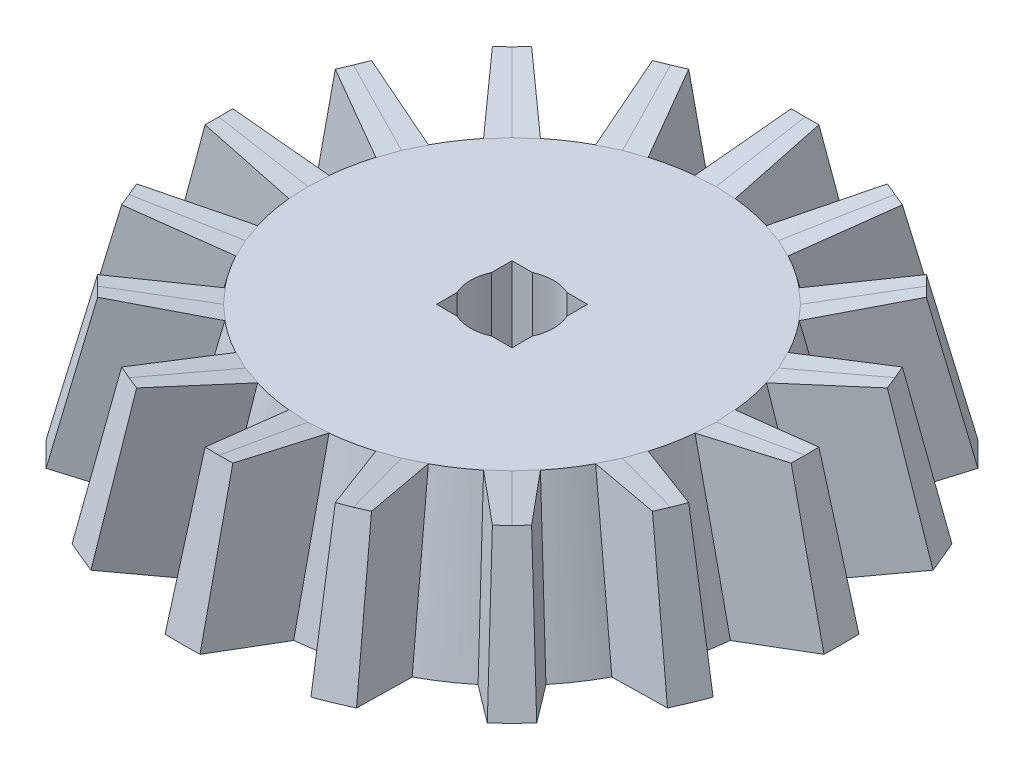
from build123d import *

# Parameters (mm, degrees)
BOSS_EXTRUDE1_DEPTH           = 3.8
BOSS_EXTRUDE1_TAPER           = 4
BOSS_EXTRUDE1_OTHER_WAY_DEPTH = 0.1
BOSS_EXTRUDE1_OTHER_WAY_DRAFT = 4
CIRPATTERN5_COUNT             = 16
CIRPATTERN5_COPY_1_DEPTH      = 0.1
CIRPATTERN5_COPY_1_DRAFT      = 4
CIRPATTERN5_COPY_2_DEPTH      = 0.1
CIRPATTERN5_COPY_2_DRAFT      = 4
CIRPATTERN5_COPY_3_DEPTH      = 0.1
CIRPATTERN5_COPY_3_DRAFT      = 4
CIRPATTERN5_COPY_4_DEPTH      = 0.1
CIRPATTERN5_COPY_4_DRAFT      = 4
CIRPATTERN5_COPY_5_DEPTH      = 0.1
CIRPATTERN5_COPY_5_DRAFT      = 4
CIRPATTERN5_COPY_6_DEPTH      = 0.1
CIRPATTERN5_COPY_6_DRAFT      = 4
CIRPATTERN5_COPY_7_DEPTH      = 0.1
CIRPATTERN5_COPY_7_DRAFT      = 4
CIRPATTERN5_COPY_8_DEPTH      = 0.1
CIRPATTERN5_COPY_8_DRAFT      = 4
CIRPATTERN5_COPY_9_DEPTH      = 0.1
CIRPATTERN5_COPY_9_DRAFT      = 4
CIRPATTERN5_COPY_10_DEPTH     = 0.1
CIRPATTERN5_COPY_10_DRAFT     = 4
CIRPATTERN5_COPY_11_DEPTH     = 0.1
CIRPATTERN5_COPY_11_DRAFT     = 4
CIRPATTERN5_COPY_12_DEPTH     = 0.1
CIRPATTERN5_COPY_12_DRAFT     = 4
CIRPATTERN5_COPY_13_DEPTH     = 0.1
CIRPATTERN5_COPY_13_DRAFT     = 4
CIRPATTERN5_COPY_14_DEPTH     = 0.1
CIRPATTERN5_COPY_14_DRAFT     = 4
CIRPATTERN5_COPY_15_DEPTH     = 0.1
CIRPATTERN5_COPY_15_DRAFT     = 4
CIRPATTERN5_COPY_16_DEPTH     = 0.1
CIRPATTERN5_COPY_16_DRAFT     = 4
CIRPATTERN5_COPY_17_DEPTH     = 0.1
CIRPATTERN5_COPY_17_DRAFT     = 4
CIRPATTERN5_COPY_18_DEPTH     = 0.1
CIRPATTERN5_COPY_18_DRAFT     = 4
CIRPATTERN5_COPY_19_DEPTH     = 0.1
CIRPATTERN5_COPY_19_DRAFT     = 4
CIRPATTERN5_COPY_20_DEPTH     = 0.1
CIRPATTERN5_COPY_20_DRAFT     = 4
CIRPATTERN5_COPY_21_DEPTH     = 0.1
CIRPATTERN5_COPY_21_DRAFT     = 4
CIRPATTERN5_COPY_22_DEPTH     = 0.1
CIRPATTERN5_COPY_22_DRAFT     = 4
CIRPATTERN5_COPY_23_DEPTH     = 0.1
CIRPATTERN5_COPY_23_DRAFT     = 4
CIRPATTERN5_COPY_24_DEPTH     = 0.1
CIRPATTERN5_COPY_24_DRAFT     = 4
CIRPATTERN5_COPY_25_DEPTH     = 0.1
CIRPATTERN5_COPY_25_DRAFT     = 4
CIRPATTERN5_COPY_26_DEPTH     = 0.1
CIRPATTERN5_COPY_26_DRAFT     = 4
CIRPATTERN5_COPY_27_DEPTH     = 0.1
CIRPATTERN5_COPY_27_DRAFT     = 4
CIRPATTERN5_COPY_28_DEPTH     = 0.1
CIRPATTERN5_COPY_28_DRAFT     = 4
CIRPATTERN5_COPY_29_DEPTH     = 0.1
CIRPATTERN5_COPY_29_DRAFT     = 4
CIRPATTERN5_COPY_30_DEPTH     = 0.1
CIRPATTERN5_COPY_30_DRAFT     = 4
SKETCH9_R                     = 1.75
CUT_EXTRUDE1_DEPTH            = 11.5
SKETCH10_W                    = 3.18
SKETCH10_H                    = 3.18
CUT_EXTRUDE3_DEPTH            = 10
SKETCH11_R                    = 13.97
CUT_EXTRUDE4_DEPTH            = 10


with BuildPart() as part:
    # Sketch1 → Revolve1 (revolve)
    with BuildSketch(Plane.XY):
        Polygon((0, 0), (10.264, 0), (8.599769277, 6.655068452), (0, 6.655068452), align=None)
    revolve(axis=Axis((0, 6.655068452, 0), (0, -1, 0)))

    # Sketch8 → Boss-Extrude1 (add)
    with BuildSketch(Plane(origin=(0, 2.41565258, 9.659918574), x_dir=(1, 0, 0), z_dir=(0, 0.24259923079541193, 0.9701265964901048))):
        Polygon((0, 4.369961495), (-0.8443, 4.380040474), (-1.0077, -2.478008782), (0, -2.490038505), (1.0077, -2.478008782), (0.8443, 4.380040474), align=None)
    boss_extrude1 = extrude(amount=BOSS_EXTRUDE1_DEPTH, taper=BOSS_EXTRUDE1_TAPER)


with BuildPart() as boss_extrude1_other_way_tool:
    # Sketch8 → Boss-Extrude1 other way (with draft: the straight prism first)
    with BuildSketch(Plane(origin=(0, 2.41565258, 9.659918574), x_dir=(1, 0, 0), z_dir=(0, 0.24259923079541193, 0.9701265964901048))):
        Polygon((0, 4.369961495), (-0.8443, 4.380040474), (-1.0077, -2.478008782), (0, -2.490038505), (1.0077, -2.478008782), (0.8443, 4.380040474), align=None)
    extrude(amount=-BOSS_EXTRUDE1_OTHER_WAY_DEPTH)
    # Boss-Extrude1 other way: the draft: its side faces are tilted about the plane it starts from
    boss_extrude1_other_way_sides = [boss_extrude1_other_way_tool.faces().sort_by_distance(p)[0] for p in [
        (-0.42215, 6.647827433, 8.550040371),
        (-0.926, 3.326128384, 9.380696532),
        (-0.50385, -0.006294784, 10.214034469),
        (0.50385, -0.006294784, 10.214034469),
        (0.926, 3.326128384, 9.380696532),
        (0.42215, 6.647827433, 8.550040371),
    ]]
    draft(boss_extrude1_other_way_sides, Plane(origin=(0, 2.41565258, 9.659918574), x_dir=(1, 0, 0), z_dir=(0, 0.24259923079541193, 0.9701265964901048)), BOSS_EXTRUDE1_OTHER_WAY_DRAFT)


with BuildPart() as part_1:
    add(part.part)

    # Boss-Extrude1 other way: add boss_extrude1_other_way_tool
    add(boss_extrude1_other_way_tool.part)

    # CirPattern5: Boss-Extrude1 ×16 about axis
    cirpattern5_axis = Axis((0, 67.611042395, 0), (0, -1, 0))
    for i in range(1, CIRPATTERN5_COUNT):
        add(boss_extrude1.rotate(cirpattern5_axis, i * 360 / CIRPATTERN5_COUNT))


with BuildPart() as cirpattern5_copy_1_tool:
    # CirPattern5 copy 1 sketch → CirPattern5 copy 1 (with draft: the straight prism first)
    with BuildSketch(Plane(origin=(-3.696690796, 2.41565258, 8.924601056), x_dir=(0.9238795325112867, 0, 0.3826834323650898), z_dir=(-0.37125137577349576, 0.24259923079541193, 0.8962801064420437))):
        Polygon((0, 4.369961495), (-0.8443, 4.380040474), (-1.0077, -2.478008782), (0, -2.490038505), (1.0077, -2.478008782), (0.8443, 4.380040474), align=None)
    extrude(amount=-CIRPATTERN5_COPY_1_DEPTH)
    # CirPattern5 copy 1: the draft: its side faces are tilted about the plane it starts from
    cirpattern5_copy_1_sides = [cirpattern5_copy_1_tool.faces().sort_by_distance(p)[0] for p in [
        (-3.661974541, 6.647827433, 7.73765749),
        (-4.445349594, 3.326128384, 8.312268668),
        (-4.374238471, -0.006294784, 9.243722343),
        (-3.443245066, -0.006294784, 9.629352438),
        (-2.7343247, 3.326128384, 9.020998385),
        (-2.881943051, 6.647827433, 8.060757112),
    ]]
    draft(cirpattern5_copy_1_sides, Plane(origin=(-3.696690796, 2.41565258, 8.924601056), x_dir=(0.9238795325112867, 0, 0.3826834323650898), z_dir=(-0.37125137577349576, 0.24259923079541193, 0.8962801064420437)), CIRPATTERN5_COPY_1_DRAFT)


with BuildPart() as part_2:
    add(part_1.part)

    # CirPattern5 copy 1: add cirpattern5_copy_1_tool
    add(cirpattern5_copy_1_tool.part)


with BuildPart() as cirpattern5_copy_2_tool:
    # CirPattern5 copy 2 sketch → CirPattern5 copy 2 (with draft: the straight prism first)
    with BuildSketch(Plane(origin=(-6.830593929, 2.41565258, 6.830593929), x_dir=(0.7071067811865476, 0, 0.7071067811865475), z_dir=(-0.6859830949875786, 0.24259923079541193, 0.6859830949875787))):
        Polygon((0, 4.369961495), (-0.8443, 4.380040474), (-1.0077, -2.478008782), (0, -2.490038505), (1.0077, -2.478008782), (0.8443, 4.380040474), align=None)
    extrude(amount=-CIRPATTERN5_COPY_2_DEPTH)
    # CirPattern5 copy 2: the draft: its side faces are tilted about the plane it starts from
    cirpattern5_copy_2_sides = [cirpattern5_copy_2_tool.faces().sort_by_distance(p)[0] for p in [
        (-6.344296653, 6.647827433, 5.747286398),
        (-7.287935009, 3.326128384, 5.978373251),
        (-7.578688788, -0.006294784, 6.866137285),
        (-6.866137285, -0.006294784, 7.578688788),
        (-5.978373251, 3.326128384, 7.287935009),
        (-5.747286398, 6.647827433, 6.344296653),
    ]]
    draft(cirpattern5_copy_2_sides, Plane(origin=(-6.830593929, 2.41565258, 6.830593929), x_dir=(0.7071067811865476, 0, 0.7071067811865475), z_dir=(-0.6859830949875786, 0.24259923079541193, 0.6859830949875787)), CIRPATTERN5_COPY_2_DRAFT)


with BuildPart() as part_3:
    add(part_2.part)

    # CirPattern5 copy 2: add cirpattern5_copy_2_tool
    add(cirpattern5_copy_2_tool.part)


with BuildPart() as cirpattern5_copy_3_tool:
    # CirPattern5 copy 3 sketch → CirPattern5 copy 3 (with draft: the straight prism first)
    with BuildSketch(Plane(origin=(-8.924601056, 2.41565258, 3.696690796), x_dir=(0.38268343236508984, 0, 0.9238795325112867), z_dir=(-0.8962801064420437, 0.24259923079541193, 0.3712513757734958))):
        Polygon((0, 4.369961495), (-0.8443, 4.380040474), (-1.0077, -2.478008782), (0, -2.490038505), (1.0077, -2.478008782), (0.8443, 4.380040474), align=None)
    extrude(amount=-CIRPATTERN5_COPY_3_DEPTH)
    # CirPattern5 copy 3: the draft: its side faces are tilted about the plane it starts from
    cirpattern5_copy_3_sides = [cirpattern5_copy_3_tool.faces().sort_by_distance(p)[0] for p in [
        (-8.060757112, 6.647827433, 2.881943051),
        (-9.020998385, 3.326128384, 2.7343247),
        (-9.629352438, -0.006294784, 3.443245066),
        (-9.243722343, -0.006294784, 4.374238471),
        (-8.312268668, 3.326128384, 4.445349594),
        (-7.73765749, 6.647827433, 3.661974541),
    ]]
    draft(cirpattern5_copy_3_sides, Plane(origin=(-8.924601056, 2.41565258, 3.696690796), x_dir=(0.38268343236508984, 0, 0.9238795325112867), z_dir=(-0.8962801064420437, 0.24259923079541193, 0.3712513757734958)), CIRPATTERN5_COPY_3_DRAFT)


with BuildPart() as part_4:
    add(part_3.part)

    # CirPattern5 copy 3: add cirpattern5_copy_3_tool
    add(cirpattern5_copy_3_tool.part)


with BuildPart() as cirpattern5_copy_4_tool:
    # CirPattern5 copy 4 sketch → CirPattern5 copy 4 (with draft: the straight prism first)
    with BuildSketch(Plane(origin=(-9.659918574, 2.41565258, 0), x_dir=(0, 0, 1), z_dir=(-0.9701265964901048, 0.24259923079541193, 0))):
        Polygon((0, 4.369961495), (-0.8443, 4.380040474), (-1.0077, -2.478008782), (0, -2.490038505), (1.0077, -2.478008782), (0.8443, 4.380040474), align=None)
    extrude(amount=-CIRPATTERN5_COPY_4_DEPTH)
    # CirPattern5 copy 4: the draft: its side faces are tilted about the plane it starts from
    cirpattern5_copy_4_sides = [cirpattern5_copy_4_tool.faces().sort_by_distance(p)[0] for p in [
        (-8.550040371, 6.647827433, -0.42215),
        (-9.380696532, 3.326128384, -0.926),
        (-10.214034469, -0.006294784, -0.50385),
        (-10.214034469, -0.006294784, 0.50385),
        (-9.380696532, 3.326128384, 0.926),
        (-8.550040371, 6.647827433, 0.42215),
    ]]
    draft(cirpattern5_copy_4_sides, Plane(origin=(-9.659918574, 2.41565258, 0), x_dir=(0, 0, 1), z_dir=(-0.9701265964901048, 0.24259923079541193, 0)), CIRPATTERN5_COPY_4_DRAFT)


with BuildPart() as part_5:
    add(part_4.part)

    # CirPattern5 copy 4: add cirpattern5_copy_4_tool
    add(cirpattern5_copy_4_tool.part)


with BuildPart() as cirpattern5_copy_5_tool:
    # CirPattern5 copy 5 sketch → CirPattern5 copy 5 (with draft: the straight prism first)
    with BuildSketch(Plane(origin=(-8.924601056, 2.41565258, -3.696690796), x_dir=(-0.3826834323650897, 0, 0.9238795325112867), z_dir=(-0.8962801064420437, 0.2425992307954119, -0.3712513757734957))):
        Polygon((0, 4.369961495), (-0.8443, 4.380040474), (-1.0077, -2.478008782), (0, -2.490038505), (1.0077, -2.478008782), (0.8443, 4.380040474), align=None)
    extrude(amount=-CIRPATTERN5_COPY_5_DEPTH)
    # CirPattern5 copy 5: the draft: its side faces are tilted about the plane it starts from
    cirpattern5_copy_5_sides = [cirpattern5_copy_5_tool.faces().sort_by_distance(p)[0] for p in [
        (-7.73765749, 6.647827433, -3.661974541),
        (-8.312268668, 3.326128384, -4.445349594),
        (-9.243722343, -0.006294784, -4.374238471),
        (-9.629352438, -0.006294784, -3.443245066),
        (-9.020998385, 3.326128384, -2.7343247),
        (-8.060757112, 6.647827433, -2.881943051),
    ]]
    draft(cirpattern5_copy_5_sides, Plane(origin=(-8.924601056, 2.41565258, -3.696690796), x_dir=(-0.3826834323650897, 0, 0.9238795325112867), z_dir=(-0.8962801064420437, 0.2425992307954119, -0.3712513757734957)), CIRPATTERN5_COPY_5_DRAFT)


with BuildPart() as part_6:
    add(part_5.part)

    # CirPattern5 copy 5: add cirpattern5_copy_5_tool
    add(cirpattern5_copy_5_tool.part)


with BuildPart() as cirpattern5_copy_6_tool:
    # CirPattern5 copy 6 sketch → CirPattern5 copy 6 (with draft: the straight prism first)
    with BuildSketch(Plane(origin=(-6.830593929, 2.41565258, -6.830593929), x_dir=(-0.7071067811865475, 0, 0.7071067811865476), z_dir=(-0.6859830949875787, 0.24259923079541193, -0.6859830949875786))):
        Polygon((0, 4.369961495), (-0.8443, 4.380040474), (-1.0077, -2.478008782), (0, -2.490038505), (1.0077, -2.478008782), (0.8443, 4.380040474), align=None)
    extrude(amount=-CIRPATTERN5_COPY_6_DEPTH)
    # CirPattern5 copy 6: the draft: its side faces are tilted about the plane it starts from
    cirpattern5_copy_6_sides = [cirpattern5_copy_6_tool.faces().sort_by_distance(p)[0] for p in [
        (-5.747286398, 6.647827433, -6.344296653),
        (-5.978373251, 3.326128384, -7.287935009),
        (-6.866137285, -0.006294784, -7.578688788),
        (-7.578688788, -0.006294784, -6.866137285),
        (-7.287935009, 3.326128384, -5.978373251),
        (-6.344296653, 6.647827433, -5.747286398),
    ]]
    draft(cirpattern5_copy_6_sides, Plane(origin=(-6.830593929, 2.41565258, -6.830593929), x_dir=(-0.7071067811865475, 0, 0.7071067811865476), z_dir=(-0.6859830949875787, 0.24259923079541193, -0.6859830949875786)), CIRPATTERN5_COPY_6_DRAFT)


with BuildPart() as part_7:
    add(part_6.part)

    # CirPattern5 copy 6: add cirpattern5_copy_6_tool
    add(cirpattern5_copy_6_tool.part)


with BuildPart() as cirpattern5_copy_7_tool:
    # CirPattern5 copy 7 sketch → CirPattern5 copy 7 (with draft: the straight prism first)
    with BuildSketch(Plane(origin=(-3.696690796, 2.41565258, -8.924601056), x_dir=(-0.9238795325112867, 0, 0.3826834323650899), z_dir=(-0.3712513757734959, 0.24259923079541193, -0.8962801064420437))):
        Polygon((0, 4.369961495), (-0.8443, 4.380040474), (-1.0077, -2.478008782), (0, -2.490038505), (1.0077, -2.478008782), (0.8443, 4.380040474), align=None)
    extrude(amount=-CIRPATTERN5_COPY_7_DEPTH)
    # CirPattern5 copy 7: the draft: its side faces are tilted about the plane it starts from
    cirpattern5_copy_7_sides = [cirpattern5_copy_7_tool.faces().sort_by_distance(p)[0] for p in [
        (-2.881943051, 6.647827433, -8.060757112),
        (-2.7343247, 3.326128384, -9.020998385),
        (-3.443245066, -0.006294784, -9.629352438),
        (-4.374238471, -0.006294784, -9.243722343),
        (-4.445349594, 3.326128384, -8.312268668),
        (-3.661974541, 6.647827433, -7.73765749),
    ]]
    draft(cirpattern5_copy_7_sides, Plane(origin=(-3.696690796, 2.41565258, -8.924601056), x_dir=(-0.9238795325112867, 0, 0.3826834323650899), z_dir=(-0.3712513757734959, 0.24259923079541193, -0.8962801064420437)), CIRPATTERN5_COPY_7_DRAFT)


with BuildPart() as part_8:
    add(part_7.part)

    # CirPattern5 copy 7: add cirpattern5_copy_7_tool
    add(cirpattern5_copy_7_tool.part)


with BuildPart() as cirpattern5_copy_8_tool:
    # CirPattern5 copy 8 sketch → CirPattern5 copy 8 (with draft: the straight prism first)
    with BuildSketch(Plane(origin=(0, 2.41565258, -9.659918574), x_dir=(-1, 0, 0), z_dir=(0, 0.24259923079541193, -0.9701265964901048))):
        Polygon((0, 4.369961495), (-0.8443, 4.380040474), (-1.0077, -2.478008782), (0, -2.490038505), (1.0077, -2.478008782), (0.8443, 4.380040474), align=None)
    extrude(amount=-CIRPATTERN5_COPY_8_DEPTH)
    # CirPattern5 copy 8: the draft: its side faces are tilted about the plane it starts from
    cirpattern5_copy_8_sides = [cirpattern5_copy_8_tool.faces().sort_by_distance(p)[0] for p in [
        (0.42215, 6.647827433, -8.550040371),
        (0.926, 3.326128384, -9.380696532),
        (0.50385, -0.006294784, -10.214034469),
        (-0.50385, -0.006294784, -10.214034469),
        (-0.926, 3.326128384, -9.380696532),
        (-0.42215, 6.647827433, -8.550040371),
    ]]
    draft(cirpattern5_copy_8_sides, Plane(origin=(0, 2.41565258, -9.659918574), x_dir=(-1, 0, 0), z_dir=(0, 0.24259923079541193, -0.9701265964901048)), CIRPATTERN5_COPY_8_DRAFT)


with BuildPart() as part_9:
    add(part_8.part)

    # CirPattern5 copy 8: add cirpattern5_copy_8_tool
    add(cirpattern5_copy_8_tool.part)


with BuildPart() as cirpattern5_copy_9_tool:
    # CirPattern5 copy 9 sketch → CirPattern5 copy 9 (with draft: the straight prism first)
    with BuildSketch(Plane(origin=(3.696690796, 2.41565258, -8.924601056), x_dir=(-0.9238795325112868, 0, -0.38268343236508967), z_dir=(0.37125137577349565, 0.24259923079541193, -0.8962801064420438))):
        Polygon((0, 4.369961495), (-0.8443, 4.380040474), (-1.0077, -2.478008782), (0, -2.490038505), (1.0077, -2.478008782), (0.8443, 4.380040474), align=None)
    extrude(amount=-CIRPATTERN5_COPY_9_DEPTH)
    # CirPattern5 copy 9: the draft: its side faces are tilted about the plane it starts from
    cirpattern5_copy_9_sides = [cirpattern5_copy_9_tool.faces().sort_by_distance(p)[0] for p in [
        (3.661974541, 6.647827433, -7.73765749),
        (4.445349594, 3.326128384, -8.312268668),
        (4.374238471, -0.006294784, -9.243722343),
        (3.443245066, -0.006294784, -9.629352438),
        (2.7343247, 3.326128384, -9.020998385),
        (2.881943051, 6.647827433, -8.060757112),
    ]]
    draft(cirpattern5_copy_9_sides, Plane(origin=(3.696690796, 2.41565258, -8.924601056), x_dir=(-0.9238795325112868, 0, -0.38268343236508967), z_dir=(0.37125137577349565, 0.24259923079541193, -0.8962801064420438)), CIRPATTERN5_COPY_9_DRAFT)


with BuildPart() as part_10:
    add(part_9.part)

    # CirPattern5 copy 9: add cirpattern5_copy_9_tool
    add(cirpattern5_copy_9_tool.part)


with BuildPart() as cirpattern5_copy_10_tool:
    # CirPattern5 copy 10 sketch → CirPattern5 copy 10 (with draft: the straight prism first)
    with BuildSketch(Plane(origin=(6.830593929, 2.41565258, -6.830593929), x_dir=(-0.7071067811865477, 0, -0.7071067811865475), z_dir=(0.6859830949875786, 0.24259923079541193, -0.6859830949875788))):
        Polygon((0, 4.369961495), (-0.8443, 4.380040474), (-1.0077, -2.478008782), (0, -2.490038505), (1.0077, -2.478008782), (0.8443, 4.380040474), align=None)
    extrude(amount=-CIRPATTERN5_COPY_10_DEPTH)
    # CirPattern5 copy 10: the draft: its side faces are tilted about the plane it starts from
    cirpattern5_copy_10_sides = [cirpattern5_copy_10_tool.faces().sort_by_distance(p)[0] for p in [
        (6.344296653, 6.647827433, -5.747286398),
        (7.287935009, 3.326128384, -5.978373251),
        (7.578688788, -0.006294784, -6.866137285),
        (6.866137285, -0.006294784, -7.578688788),
        (5.978373251, 3.326128384, -7.287935009),
        (5.747286398, 6.647827433, -6.344296653),
    ]]
    draft(cirpattern5_copy_10_sides, Plane(origin=(6.830593929, 2.41565258, -6.830593929), x_dir=(-0.7071067811865477, 0, -0.7071067811865475), z_dir=(0.6859830949875786, 0.24259923079541193, -0.6859830949875788)), CIRPATTERN5_COPY_10_DRAFT)


with BuildPart() as part_11:
    add(part_10.part)

    # CirPattern5 copy 10: add cirpattern5_copy_10_tool
    add(cirpattern5_copy_10_tool.part)


with BuildPart() as cirpattern5_copy_11_tool:
    # CirPattern5 copy 11 sketch → CirPattern5 copy 11 (with draft: the straight prism first)
    with BuildSketch(Plane(origin=(8.924601056, 2.41565258, -3.696690796), x_dir=(-0.3826834323650895, 0, -0.9238795325112868), z_dir=(0.8962801064420438, 0.24259923079541193, -0.3712513757734955))):
        Polygon((0, 4.369961495), (-0.8443, 4.380040474), (-1.0077, -2.478008782), (0, -2.490038505), (1.0077, -2.478008782), (0.8443, 4.380040474), align=None)
    extrude(amount=-CIRPATTERN5_COPY_11_DEPTH)
    # CirPattern5 copy 11: the draft: its side faces are tilted about the plane it starts from
    cirpattern5_copy_11_sides = [cirpattern5_copy_11_tool.faces().sort_by_distance(p)[0] for p in [
        (8.060757112, 6.647827433, -2.881943051),
        (9.020998385, 3.326128384, -2.7343247),
        (9.629352438, -0.006294784, -3.443245066),
        (9.243722343, -0.006294784, -4.374238471),
        (8.312268668, 3.326128384, -4.445349594),
        (7.73765749, 6.647827433, -3.661974541),
    ]]
    draft(cirpattern5_copy_11_sides, Plane(origin=(8.924601056, 2.41565258, -3.696690796), x_dir=(-0.3826834323650895, 0, -0.9238795325112868), z_dir=(0.8962801064420438, 0.24259923079541193, -0.3712513757734955)), CIRPATTERN5_COPY_11_DRAFT)


with BuildPart() as part_12:
    add(part_11.part)

    # CirPattern5 copy 11: add cirpattern5_copy_11_tool
    add(cirpattern5_copy_11_tool.part)


with BuildPart() as cirpattern5_copy_12_tool:
    # CirPattern5 copy 12 sketch → CirPattern5 copy 12 (with draft: the straight prism first)
    with BuildSketch(Plane(origin=(9.659918574, 2.41565258, 0), x_dir=(0, 0, -1), z_dir=(0.9701265964901048, 0.24259923079541193, 0))):
        Polygon((0, 4.369961495), (-0.8443, 4.380040474), (-1.0077, -2.478008782), (0, -2.490038505), (1.0077, -2.478008782), (0.8443, 4.380040474), align=None)
    extrude(amount=-CIRPATTERN5_COPY_12_DEPTH)
    # CirPattern5 copy 12: the draft: its side faces are tilted about the plane it starts from
    cirpattern5_copy_12_sides = [cirpattern5_copy_12_tool.faces().sort_by_distance(p)[0] for p in [
        (8.550040371, 6.647827433, 0.42215),
        (9.380696532, 3.326128384, 0.926),
        (10.214034469, -0.006294784, 0.50385),
        (10.214034469, -0.006294784, -0.50385),
        (9.380696532, 3.326128384, -0.926),
        (8.550040371, 6.647827433, -0.42215),
    ]]
    draft(cirpattern5_copy_12_sides, Plane(origin=(9.659918574, 2.41565258, 0), x_dir=(0, 0, -1), z_dir=(0.9701265964901048, 0.24259923079541193, 0)), CIRPATTERN5_COPY_12_DRAFT)


with BuildPart() as part_13:
    add(part_12.part)

    # CirPattern5 copy 12: add cirpattern5_copy_12_tool
    add(cirpattern5_copy_12_tool.part)


with BuildPart() as cirpattern5_copy_13_tool:
    # CirPattern5 copy 13 sketch → CirPattern5 copy 13 (with draft: the straight prism first)
    with BuildSketch(Plane(origin=(8.924601056, 2.41565258, 3.696690796), x_dir=(0.38268343236509, 0, -0.9238795325112866), z_dir=(0.8962801064420436, 0.24259923079541193, 0.371251375773496))):
        Polygon((0, 4.369961495), (-0.8443, 4.380040474), (-1.0077, -2.478008782), (0, -2.490038505), (1.0077, -2.478008782), (0.8443, 4.380040474), align=None)
    extrude(amount=-CIRPATTERN5_COPY_13_DEPTH)
    # CirPattern5 copy 13: the draft: its side faces are tilted about the plane it starts from
    cirpattern5_copy_13_sides = [cirpattern5_copy_13_tool.faces().sort_by_distance(p)[0] for p in [
        (7.73765749, 6.647827433, 3.661974541),
        (8.312268668, 3.326128384, 4.445349594),
        (9.243722343, -0.006294784, 4.374238471),
        (9.629352438, -0.006294784, 3.443245066),
        (9.020998385, 3.326128384, 2.7343247),
        (8.060757112, 6.647827433, 2.881943051),
    ]]
    draft(cirpattern5_copy_13_sides, Plane(origin=(8.924601056, 2.41565258, 3.696690796), x_dir=(0.38268343236509, 0, -0.9238795325112866), z_dir=(0.8962801064420436, 0.24259923079541193, 0.371251375773496)), CIRPATTERN5_COPY_13_DRAFT)


with BuildPart() as part_14:
    add(part_13.part)

    # CirPattern5 copy 13: add cirpattern5_copy_13_tool
    add(cirpattern5_copy_13_tool.part)


with BuildPart() as cirpattern5_copy_14_tool:
    # CirPattern5 copy 14 sketch → CirPattern5 copy 14 (with draft: the straight prism first)
    with BuildSketch(Plane(origin=(6.830593929, 2.41565258, 6.830593929), x_dir=(0.7071067811865474, 0, -0.7071067811865477), z_dir=(0.6859830949875788, 0.24259923079541193, 0.6859830949875785))):
        Polygon((0, 4.369961495), (-0.8443, 4.380040474), (-1.0077, -2.478008782), (0, -2.490038505), (1.0077, -2.478008782), (0.8443, 4.380040474), align=None)
    extrude(amount=-CIRPATTERN5_COPY_14_DEPTH)
    # CirPattern5 copy 14: the draft: its side faces are tilted about the plane it starts from
    cirpattern5_copy_14_sides = [cirpattern5_copy_14_tool.faces().sort_by_distance(p)[0] for p in [
        (5.747286398, 6.647827433, 6.344296653),
        (5.978373251, 3.326128384, 7.287935009),
        (6.866137285, -0.006294784, 7.578688788),
        (7.578688788, -0.006294784, 6.866137285),
        (7.287935009, 3.326128384, 5.978373251),
        (6.344296653, 6.647827433, 5.747286398),
    ]]
    draft(cirpattern5_copy_14_sides, Plane(origin=(6.830593929, 2.41565258, 6.830593929), x_dir=(0.7071067811865474, 0, -0.7071067811865477), z_dir=(0.6859830949875788, 0.24259923079541193, 0.6859830949875785)), CIRPATTERN5_COPY_14_DRAFT)


with BuildPart() as part_15:
    add(part_14.part)

    # CirPattern5 copy 14: add cirpattern5_copy_14_tool
    add(cirpattern5_copy_14_tool.part)


with BuildPart() as cirpattern5_copy_15_tool:
    # CirPattern5 copy 15 sketch → CirPattern5 copy 15 (with draft: the straight prism first)
    with BuildSketch(Plane(origin=(3.696690796, 2.41565258, 8.924601056), x_dir=(0.9238795325112868, 0, -0.38268343236508956), z_dir=(0.37125137577349554, 0.24259923079541193, 0.8962801064420438))):
        Polygon((0, 4.369961495), (-0.8443, 4.380040474), (-1.0077, -2.478008782), (0, -2.490038505), (1.0077, -2.478008782), (0.8443, 4.380040474), align=None)
    extrude(amount=-CIRPATTERN5_COPY_15_DEPTH)
    # CirPattern5 copy 15: the draft: its side faces are tilted about the plane it starts from
    cirpattern5_copy_15_sides = [cirpattern5_copy_15_tool.faces().sort_by_distance(p)[0] for p in [
        (2.881943051, 6.647827433, 8.060757112),
        (2.7343247, 3.326128384, 9.020998385),
        (3.443245066, -0.006294784, 9.629352438),
        (4.374238471, -0.006294784, 9.243722343),
        (4.445349594, 3.326128384, 8.312268668),
        (3.661974541, 6.647827433, 7.73765749),
    ]]
    draft(cirpattern5_copy_15_sides, Plane(origin=(3.696690796, 2.41565258, 8.924601056), x_dir=(0.9238795325112868, 0, -0.38268343236508956), z_dir=(0.37125137577349554, 0.24259923079541193, 0.8962801064420438)), CIRPATTERN5_COPY_15_DRAFT)


with BuildPart() as part_16:
    add(part_15.part)

    # CirPattern5 copy 15: add cirpattern5_copy_15_tool
    add(cirpattern5_copy_15_tool.part)


with BuildPart() as cirpattern5_copy_16_tool:
    # CirPattern5 copy 16 sketch → CirPattern5 copy 16 (with draft: the straight prism first)
    with BuildSketch(Plane(origin=(-3.696690796, 2.41565258, 8.924601056), x_dir=(0.9238795325112867, 0, 0.3826834323650898), z_dir=(-0.37125137577349576, 0.24259923079541193, 0.8962801064420437))):
        Polygon((0, 4.369961495), (-0.8443, 4.380040474), (-1.0077, -2.478008782), (0, -2.490038505), (1.0077, -2.478008782), (0.8443, 4.380040474), align=None)
    extrude(amount=-CIRPATTERN5_COPY_16_DEPTH)
    # CirPattern5 copy 16: the draft: its side faces are tilted about the plane it starts from
    cirpattern5_copy_16_sides = [cirpattern5_copy_16_tool.faces().sort_by_distance(p)[0] for p in [
        (-3.661974541, 6.647827433, 7.73765749),
        (-4.445349594, 3.326128384, 8.312268668),
        (-4.374238471, -0.006294784, 9.243722343),
        (-3.443245066, -0.006294784, 9.629352438),
        (-2.7343247, 3.326128384, 9.020998385),
        (-2.881943051, 6.647827433, 8.060757112),
    ]]
    draft(cirpattern5_copy_16_sides, Plane(origin=(-3.696690796, 2.41565258, 8.924601056), x_dir=(0.9238795325112867, 0, 0.3826834323650898), z_dir=(-0.37125137577349576, 0.24259923079541193, 0.8962801064420437)), CIRPATTERN5_COPY_16_DRAFT)


with BuildPart() as part_17:
    add(part_16.part)

    # CirPattern5 copy 16: add cirpattern5_copy_16_tool
    add(cirpattern5_copy_16_tool.part)


with BuildPart() as cirpattern5_copy_17_tool:
    # CirPattern5 copy 17 sketch → CirPattern5 copy 17 (with draft: the straight prism first)
    with BuildSketch(Plane(origin=(-6.830593929, 2.41565258, 6.830593929), x_dir=(0.7071067811865476, 0, 0.7071067811865475), z_dir=(-0.6859830949875786, 0.24259923079541193, 0.6859830949875787))):
        Polygon((0, 4.369961495), (-0.8443, 4.380040474), (-1.0077, -2.478008782), (0, -2.490038505), (1.0077, -2.478008782), (0.8443, 4.380040474), align=None)
    extrude(amount=-CIRPATTERN5_COPY_17_DEPTH)
    # CirPattern5 copy 17: the draft: its side faces are tilted about the plane it starts from
    cirpattern5_copy_17_sides = [cirpattern5_copy_17_tool.faces().sort_by_distance(p)[0] for p in [
        (-6.344296653, 6.647827433, 5.747286398),
        (-7.287935009, 3.326128384, 5.978373251),
        (-7.578688788, -0.006294784, 6.866137285),
        (-6.866137285, -0.006294784, 7.578688788),
        (-5.978373251, 3.326128384, 7.287935009),
        (-5.747286398, 6.647827433, 6.344296653),
    ]]
    draft(cirpattern5_copy_17_sides, Plane(origin=(-6.830593929, 2.41565258, 6.830593929), x_dir=(0.7071067811865476, 0, 0.7071067811865475), z_dir=(-0.6859830949875786, 0.24259923079541193, 0.6859830949875787)), CIRPATTERN5_COPY_17_DRAFT)


with BuildPart() as part_18:
    add(part_17.part)

    # CirPattern5 copy 17: add cirpattern5_copy_17_tool
    add(cirpattern5_copy_17_tool.part)


with BuildPart() as cirpattern5_copy_18_tool:
    # CirPattern5 copy 18 sketch → CirPattern5 copy 18 (with draft: the straight prism first)
    with BuildSketch(Plane(origin=(-8.924601056, 2.41565258, 3.696690796), x_dir=(0.38268343236508984, 0, 0.9238795325112867), z_dir=(-0.8962801064420437, 0.24259923079541193, 0.3712513757734958))):
        Polygon((0, 4.369961495), (-0.8443, 4.380040474), (-1.0077, -2.478008782), (0, -2.490038505), (1.0077, -2.478008782), (0.8443, 4.380040474), align=None)
    extrude(amount=-CIRPATTERN5_COPY_18_DEPTH)
    # CirPattern5 copy 18: the draft: its side faces are tilted about the plane it starts from
    cirpattern5_copy_18_sides = [cirpattern5_copy_18_tool.faces().sort_by_distance(p)[0] for p in [
        (-8.060757112, 6.647827433, 2.881943051),
        (-9.020998385, 3.326128384, 2.7343247),
        (-9.629352438, -0.006294784, 3.443245066),
        (-9.243722343, -0.006294784, 4.374238471),
        (-8.312268668, 3.326128384, 4.445349594),
        (-7.73765749, 6.647827433, 3.661974541),
    ]]
    draft(cirpattern5_copy_18_sides, Plane(origin=(-8.924601056, 2.41565258, 3.696690796), x_dir=(0.38268343236508984, 0, 0.9238795325112867), z_dir=(-0.8962801064420437, 0.24259923079541193, 0.3712513757734958)), CIRPATTERN5_COPY_18_DRAFT)


with BuildPart() as part_19:
    add(part_18.part)

    # CirPattern5 copy 18: add cirpattern5_copy_18_tool
    add(cirpattern5_copy_18_tool.part)


with BuildPart() as cirpattern5_copy_19_tool:
    # CirPattern5 copy 19 sketch → CirPattern5 copy 19 (with draft: the straight prism first)
    with BuildSketch(Plane(origin=(-9.659918574, 2.41565258, 0), x_dir=(0, 0, 1), z_dir=(-0.9701265964901048, 0.24259923079541193, 0))):
        Polygon((0, 4.369961495), (-0.8443, 4.380040474), (-1.0077, -2.478008782), (0, -2.490038505), (1.0077, -2.478008782), (0.8443, 4.380040474), align=None)
    extrude(amount=-CIRPATTERN5_COPY_19_DEPTH)
    # CirPattern5 copy 19: the draft: its side faces are tilted about the plane it starts from
    cirpattern5_copy_19_sides = [cirpattern5_copy_19_tool.faces().sort_by_distance(p)[0] for p in [
        (-8.550040371, 6.647827433, -0.42215),
        (-9.380696532, 3.326128384, -0.926),
        (-10.214034469, -0.006294784, -0.50385),
        (-10.214034469, -0.006294784, 0.50385),
        (-9.380696532, 3.326128384, 0.926),
        (-8.550040371, 6.647827433, 0.42215),
    ]]
    draft(cirpattern5_copy_19_sides, Plane(origin=(-9.659918574, 2.41565258, 0), x_dir=(0, 0, 1), z_dir=(-0.9701265964901048, 0.24259923079541193, 0)), CIRPATTERN5_COPY_19_DRAFT)


with BuildPart() as part_20:
    add(part_19.part)

    # CirPattern5 copy 19: add cirpattern5_copy_19_tool
    add(cirpattern5_copy_19_tool.part)


with BuildPart() as cirpattern5_copy_20_tool:
    # CirPattern5 copy 20 sketch → CirPattern5 copy 20 (with draft: the straight prism first)
    with BuildSketch(Plane(origin=(-8.924601056, 2.41565258, -3.696690796), x_dir=(-0.3826834323650897, 0, 0.9238795325112867), z_dir=(-0.8962801064420437, 0.2425992307954119, -0.3712513757734957))):
        Polygon((0, 4.369961495), (-0.8443, 4.380040474), (-1.0077, -2.478008782), (0, -2.490038505), (1.0077, -2.478008782), (0.8443, 4.380040474), align=None)
    extrude(amount=-CIRPATTERN5_COPY_20_DEPTH)
    # CirPattern5 copy 20: the draft: its side faces are tilted about the plane it starts from
    cirpattern5_copy_20_sides = [cirpattern5_copy_20_tool.faces().sort_by_distance(p)[0] for p in [
        (-7.73765749, 6.647827433, -3.661974541),
        (-8.312268668, 3.326128384, -4.445349594),
        (-9.243722343, -0.006294784, -4.374238471),
        (-9.629352438, -0.006294784, -3.443245066),
        (-9.020998385, 3.326128384, -2.7343247),
        (-8.060757112, 6.647827433, -2.881943051),
    ]]
    draft(cirpattern5_copy_20_sides, Plane(origin=(-8.924601056, 2.41565258, -3.696690796), x_dir=(-0.3826834323650897, 0, 0.9238795325112867), z_dir=(-0.8962801064420437, 0.2425992307954119, -0.3712513757734957)), CIRPATTERN5_COPY_20_DRAFT)


with BuildPart() as part_21:
    add(part_20.part)

    # CirPattern5 copy 20: add cirpattern5_copy_20_tool
    add(cirpattern5_copy_20_tool.part)


with BuildPart() as cirpattern5_copy_21_tool:
    # CirPattern5 copy 21 sketch → CirPattern5 copy 21 (with draft: the straight prism first)
    with BuildSketch(Plane(origin=(-6.830593929, 2.41565258, -6.830593929), x_dir=(-0.7071067811865475, 0, 0.7071067811865476), z_dir=(-0.6859830949875787, 0.24259923079541193, -0.6859830949875786))):
        Polygon((0, 4.369961495), (-0.8443, 4.380040474), (-1.0077, -2.478008782), (0, -2.490038505), (1.0077, -2.478008782), (0.8443, 4.380040474), align=None)
    extrude(amount=-CIRPATTERN5_COPY_21_DEPTH)
    # CirPattern5 copy 21: the draft: its side faces are tilted about the plane it starts from
    cirpattern5_copy_21_sides = [cirpattern5_copy_21_tool.faces().sort_by_distance(p)[0] for p in [
        (-5.747286398, 6.647827433, -6.344296653),
        (-5.978373251, 3.326128384, -7.287935009),
        (-6.866137285, -0.006294784, -7.578688788),
        (-7.578688788, -0.006294784, -6.866137285),
        (-7.287935009, 3.326128384, -5.978373251),
        (-6.344296653, 6.647827433, -5.747286398),
    ]]
    draft(cirpattern5_copy_21_sides, Plane(origin=(-6.830593929, 2.41565258, -6.830593929), x_dir=(-0.7071067811865475, 0, 0.7071067811865476), z_dir=(-0.6859830949875787, 0.24259923079541193, -0.6859830949875786)), CIRPATTERN5_COPY_21_DRAFT)


with BuildPart() as part_22:
    add(part_21.part)

    # CirPattern5 copy 21: add cirpattern5_copy_21_tool
    add(cirpattern5_copy_21_tool.part)


with BuildPart() as cirpattern5_copy_22_tool:
    # CirPattern5 copy 22 sketch → CirPattern5 copy 22 (with draft: the straight prism first)
    with BuildSketch(Plane(origin=(-3.696690796, 2.41565258, -8.924601056), x_dir=(-0.9238795325112867, 0, 0.3826834323650899), z_dir=(-0.3712513757734959, 0.24259923079541193, -0.8962801064420437))):
        Polygon((0, 4.369961495), (-0.8443, 4.380040474), (-1.0077, -2.478008782), (0, -2.490038505), (1.0077, -2.478008782), (0.8443, 4.380040474), align=None)
    extrude(amount=-CIRPATTERN5_COPY_22_DEPTH)
    # CirPattern5 copy 22: the draft: its side faces are tilted about the plane it starts from
    cirpattern5_copy_22_sides = [cirpattern5_copy_22_tool.faces().sort_by_distance(p)[0] for p in [
        (-2.881943051, 6.647827433, -8.060757112),
        (-2.7343247, 3.326128384, -9.020998385),
        (-3.443245066, -0.006294784, -9.629352438),
        (-4.374238471, -0.006294784, -9.243722343),
        (-4.445349594, 3.326128384, -8.312268668),
        (-3.661974541, 6.647827433, -7.73765749),
    ]]
    draft(cirpattern5_copy_22_sides, Plane(origin=(-3.696690796, 2.41565258, -8.924601056), x_dir=(-0.9238795325112867, 0, 0.3826834323650899), z_dir=(-0.3712513757734959, 0.24259923079541193, -0.8962801064420437)), CIRPATTERN5_COPY_22_DRAFT)


with BuildPart() as part_23:
    add(part_22.part)

    # CirPattern5 copy 22: add cirpattern5_copy_22_tool
    add(cirpattern5_copy_22_tool.part)


with BuildPart() as cirpattern5_copy_23_tool:
    # CirPattern5 copy 23 sketch → CirPattern5 copy 23 (with draft: the straight prism first)
    with BuildSketch(Plane(origin=(0, 2.41565258, -9.659918574), x_dir=(-1, 0, 0), z_dir=(0, 0.24259923079541193, -0.9701265964901048))):
        Polygon((0, 4.369961495), (-0.8443, 4.380040474), (-1.0077, -2.478008782), (0, -2.490038505), (1.0077, -2.478008782), (0.8443, 4.380040474), align=None)
    extrude(amount=-CIRPATTERN5_COPY_23_DEPTH)
    # CirPattern5 copy 23: the draft: its side faces are tilted about the plane it starts from
    cirpattern5_copy_23_sides = [cirpattern5_copy_23_tool.faces().sort_by_distance(p)[0] for p in [
        (0.42215, 6.647827433, -8.550040371),
        (0.926, 3.326128384, -9.380696532),
        (0.50385, -0.006294784, -10.214034469),
        (-0.50385, -0.006294784, -10.214034469),
        (-0.926, 3.326128384, -9.380696532),
        (-0.42215, 6.647827433, -8.550040371),
    ]]
    draft(cirpattern5_copy_23_sides, Plane(origin=(0, 2.41565258, -9.659918574), x_dir=(-1, 0, 0), z_dir=(0, 0.24259923079541193, -0.9701265964901048)), CIRPATTERN5_COPY_23_DRAFT)


with BuildPart() as part_24:
    add(part_23.part)

    # CirPattern5 copy 23: add cirpattern5_copy_23_tool
    add(cirpattern5_copy_23_tool.part)


with BuildPart() as cirpattern5_copy_24_tool:
    # CirPattern5 copy 24 sketch → CirPattern5 copy 24 (with draft: the straight prism first)
    with BuildSketch(Plane(origin=(3.696690796, 2.41565258, -8.924601056), x_dir=(-0.9238795325112868, 0, -0.38268343236508967), z_dir=(0.37125137577349565, 0.24259923079541193, -0.8962801064420438))):
        Polygon((0, 4.369961495), (-0.8443, 4.380040474), (-1.0077, -2.478008782), (0, -2.490038505), (1.0077, -2.478008782), (0.8443, 4.380040474), align=None)
    extrude(amount=-CIRPATTERN5_COPY_24_DEPTH)
    # CirPattern5 copy 24: the draft: its side faces are tilted about the plane it starts from
    cirpattern5_copy_24_sides = [cirpattern5_copy_24_tool.faces().sort_by_distance(p)[0] for p in [
        (3.661974541, 6.647827433, -7.73765749),
        (4.445349594, 3.326128384, -8.312268668),
        (4.374238471, -0.006294784, -9.243722343),
        (3.443245066, -0.006294784, -9.629352438),
        (2.7343247, 3.326128384, -9.020998385),
        (2.881943051, 6.647827433, -8.060757112),
    ]]
    draft(cirpattern5_copy_24_sides, Plane(origin=(3.696690796, 2.41565258, -8.924601056), x_dir=(-0.9238795325112868, 0, -0.38268343236508967), z_dir=(0.37125137577349565, 0.24259923079541193, -0.8962801064420438)), CIRPATTERN5_COPY_24_DRAFT)


with BuildPart() as part_25:
    add(part_24.part)

    # CirPattern5 copy 24: add cirpattern5_copy_24_tool
    add(cirpattern5_copy_24_tool.part)


with BuildPart() as cirpattern5_copy_25_tool:
    # CirPattern5 copy 25 sketch → CirPattern5 copy 25 (with draft: the straight prism first)
    with BuildSketch(Plane(origin=(6.830593929, 2.41565258, -6.830593929), x_dir=(-0.7071067811865477, 0, -0.7071067811865475), z_dir=(0.6859830949875786, 0.24259923079541193, -0.6859830949875788))):
        Polygon((0, 4.369961495), (-0.8443, 4.380040474), (-1.0077, -2.478008782), (0, -2.490038505), (1.0077, -2.478008782), (0.8443, 4.380040474), align=None)
    extrude(amount=-CIRPATTERN5_COPY_25_DEPTH)
    # CirPattern5 copy 25: the draft: its side faces are tilted about the plane it starts from
    cirpattern5_copy_25_sides = [cirpattern5_copy_25_tool.faces().sort_by_distance(p)[0] for p in [
        (6.344296653, 6.647827433, -5.747286398),
        (7.287935009, 3.326128384, -5.978373251),
        (7.578688788, -0.006294784, -6.866137285),
        (6.866137285, -0.006294784, -7.578688788),
        (5.978373251, 3.326128384, -7.287935009),
        (5.747286398, 6.647827433, -6.344296653),
    ]]
    draft(cirpattern5_copy_25_sides, Plane(origin=(6.830593929, 2.41565258, -6.830593929), x_dir=(-0.7071067811865477, 0, -0.7071067811865475), z_dir=(0.6859830949875786, 0.24259923079541193, -0.6859830949875788)), CIRPATTERN5_COPY_25_DRAFT)


with BuildPart() as part_26:
    add(part_25.part)

    # CirPattern5 copy 25: add cirpattern5_copy_25_tool
    add(cirpattern5_copy_25_tool.part)


with BuildPart() as cirpattern5_copy_26_tool:
    # CirPattern5 copy 26 sketch → CirPattern5 copy 26 (with draft: the straight prism first)
    with BuildSketch(Plane(origin=(8.924601056, 2.41565258, -3.696690796), x_dir=(-0.3826834323650895, 0, -0.9238795325112868), z_dir=(0.8962801064420438, 0.24259923079541193, -0.3712513757734955))):
        Polygon((0, 4.369961495), (-0.8443, 4.380040474), (-1.0077, -2.478008782), (0, -2.490038505), (1.0077, -2.478008782), (0.8443, 4.380040474), align=None)
    extrude(amount=-CIRPATTERN5_COPY_26_DEPTH)
    # CirPattern5 copy 26: the draft: its side faces are tilted about the plane it starts from
    cirpattern5_copy_26_sides = [cirpattern5_copy_26_tool.faces().sort_by_distance(p)[0] for p in [
        (8.060757112, 6.647827433, -2.881943051),
        (9.020998385, 3.326128384, -2.7343247),
        (9.629352438, -0.006294784, -3.443245066),
        (9.243722343, -0.006294784, -4.374238471),
        (8.312268668, 3.326128384, -4.445349594),
        (7.73765749, 6.647827433, -3.661974541),
    ]]
    draft(cirpattern5_copy_26_sides, Plane(origin=(8.924601056, 2.41565258, -3.696690796), x_dir=(-0.3826834323650895, 0, -0.9238795325112868), z_dir=(0.8962801064420438, 0.24259923079541193, -0.3712513757734955)), CIRPATTERN5_COPY_26_DRAFT)


with BuildPart() as part_27:
    add(part_26.part)

    # CirPattern5 copy 26: add cirpattern5_copy_26_tool
    add(cirpattern5_copy_26_tool.part)


with BuildPart() as cirpattern5_copy_27_tool:
    # CirPattern5 copy 27 sketch → CirPattern5 copy 27 (with draft: the straight prism first)
    with BuildSketch(Plane(origin=(9.659918574, 2.41565258, 0), x_dir=(0, 0, -1), z_dir=(0.9701265964901048, 0.24259923079541193, 0))):
        Polygon((0, 4.369961495), (-0.8443, 4.380040474), (-1.0077, -2.478008782), (0, -2.490038505), (1.0077, -2.478008782), (0.8443, 4.380040474), align=None)
    extrude(amount=-CIRPATTERN5_COPY_27_DEPTH)
    # CirPattern5 copy 27: the draft: its side faces are tilted about the plane it starts from
    cirpattern5_copy_27_sides = [cirpattern5_copy_27_tool.faces().sort_by_distance(p)[0] for p in [
        (8.550040371, 6.647827433, 0.42215),
        (9.380696532, 3.326128384, 0.926),
        (10.214034469, -0.006294784, 0.50385),
        (10.214034469, -0.006294784, -0.50385),
        (9.380696532, 3.326128384, -0.926),
        (8.550040371, 6.647827433, -0.42215),
    ]]
    draft(cirpattern5_copy_27_sides, Plane(origin=(9.659918574, 2.41565258, 0), x_dir=(0, 0, -1), z_dir=(0.9701265964901048, 0.24259923079541193, 0)), CIRPATTERN5_COPY_27_DRAFT)


with BuildPart() as part_28:
    add(part_27.part)

    # CirPattern5 copy 27: add cirpattern5_copy_27_tool
    add(cirpattern5_copy_27_tool.part)


with BuildPart() as cirpattern5_copy_28_tool:
    # CirPattern5 copy 28 sketch → CirPattern5 copy 28 (with draft: the straight prism first)
    with BuildSketch(Plane(origin=(8.924601056, 2.41565258, 3.696690796), x_dir=(0.38268343236509, 0, -0.9238795325112866), z_dir=(0.8962801064420436, 0.24259923079541193, 0.371251375773496))):
        Polygon((0, 4.369961495), (-0.8443, 4.380040474), (-1.0077, -2.478008782), (0, -2.490038505), (1.0077, -2.478008782), (0.8443, 4.380040474), align=None)
    extrude(amount=-CIRPATTERN5_COPY_28_DEPTH)
    # CirPattern5 copy 28: the draft: its side faces are tilted about the plane it starts from
    cirpattern5_copy_28_sides = [cirpattern5_copy_28_tool.faces().sort_by_distance(p)[0] for p in [
        (7.73765749, 6.647827433, 3.661974541),
        (8.312268668, 3.326128384, 4.445349594),
        (9.243722343, -0.006294784, 4.374238471),
        (9.629352438, -0.006294784, 3.443245066),
        (9.020998385, 3.326128384, 2.7343247),
        (8.060757112, 6.647827433, 2.881943051),
    ]]
    draft(cirpattern5_copy_28_sides, Plane(origin=(8.924601056, 2.41565258, 3.696690796), x_dir=(0.38268343236509, 0, -0.9238795325112866), z_dir=(0.8962801064420436, 0.24259923079541193, 0.371251375773496)), CIRPATTERN5_COPY_28_DRAFT)


with BuildPart() as part_29:
    add(part_28.part)

    # CirPattern5 copy 28: add cirpattern5_copy_28_tool
    add(cirpattern5_copy_28_tool.part)


with BuildPart() as cirpattern5_copy_29_tool:
    # CirPattern5 copy 29 sketch → CirPattern5 copy 29 (with draft: the straight prism first)
    with BuildSketch(Plane(origin=(6.830593929, 2.41565258, 6.830593929), x_dir=(0.7071067811865474, 0, -0.7071067811865477), z_dir=(0.6859830949875788, 0.24259923079541193, 0.6859830949875785))):
        Polygon((0, 4.369961495), (-0.8443, 4.380040474), (-1.0077, -2.478008782), (0, -2.490038505), (1.0077, -2.478008782), (0.8443, 4.380040474), align=None)
    extrude(amount=-CIRPATTERN5_COPY_29_DEPTH)
    # CirPattern5 copy 29: the draft: its side faces are tilted about the plane it starts from
    cirpattern5_copy_29_sides = [cirpattern5_copy_29_tool.faces().sort_by_distance(p)[0] for p in [
        (5.747286398, 6.647827433, 6.344296653),
        (5.978373251, 3.326128384, 7.287935009),
        (6.866137285, -0.006294784, 7.578688788),
        (7.578688788, -0.006294784, 6.866137285),
        (7.287935009, 3.326128384, 5.978373251),
        (6.344296653, 6.647827433, 5.747286398),
    ]]
    draft(cirpattern5_copy_29_sides, Plane(origin=(6.830593929, 2.41565258, 6.830593929), x_dir=(0.7071067811865474, 0, -0.7071067811865477), z_dir=(0.6859830949875788, 0.24259923079541193, 0.6859830949875785)), CIRPATTERN5_COPY_29_DRAFT)


with BuildPart() as part_30:
    add(part_29.part)

    # CirPattern5 copy 29: add cirpattern5_copy_29_tool
    add(cirpattern5_copy_29_tool.part)


with BuildPart() as cirpattern5_copy_30_tool:
    # CirPattern5 copy 30 sketch → CirPattern5 copy 30 (with draft: the straight prism first)
    with BuildSketch(Plane(origin=(3.696690796, 2.41565258, 8.924601056), x_dir=(0.9238795325112868, 0, -0.38268343236508956), z_dir=(0.37125137577349554, 0.24259923079541193, 0.8962801064420438))):
        Polygon((0, 4.369961495), (-0.8443, 4.380040474), (-1.0077, -2.478008782), (0, -2.490038505), (1.0077, -2.478008782), (0.8443, 4.380040474), align=None)
    extrude(amount=-CIRPATTERN5_COPY_30_DEPTH)
    # CirPattern5 copy 30: the draft: its side faces are tilted about the plane it starts from
    cirpattern5_copy_30_sides = [cirpattern5_copy_30_tool.faces().sort_by_distance(p)[0] for p in [
        (2.881943051, 6.647827433, 8.060757112),
        (2.7343247, 3.326128384, 9.020998385),
        (3.443245066, -0.006294784, 9.629352438),
        (4.374238471, -0.006294784, 9.243722343),
        (4.445349594, 3.326128384, 8.312268668),
        (3.661974541, 6.647827433, 7.73765749),
    ]]
    draft(cirpattern5_copy_30_sides, Plane(origin=(3.696690796, 2.41565258, 8.924601056), x_dir=(0.9238795325112868, 0, -0.38268343236508956), z_dir=(0.37125137577349554, 0.24259923079541193, 0.8962801064420438)), CIRPATTERN5_COPY_30_DRAFT)


with BuildPart() as part_31:
    add(part_30.part)

    # CirPattern5 copy 30: add cirpattern5_copy_30_tool
    add(cirpattern5_copy_30_tool.part)

    # Sketch9 → Cut-Extrude1 (cut)
    with BuildSketch(Plane(origin=(0, 6.655068452, 0), x_dir=(1, 0, 0), z_dir=(0, 1, 0))):
        Circle(SKETCH9_R)
    extrude(amount=-CUT_EXTRUDE1_DEPTH, mode=Mode.SUBTRACT)

    # Sketch10 → Cut-Extrude3 (cut)
    with BuildSketch(Plane(origin=(0, 0, 0), x_dir=(1, 0, 0), z_dir=(0, 1, 0))):
        Rectangle(SKETCH10_W, SKETCH10_H)
    extrude(amount=CUT_EXTRUDE3_DEPTH, mode=Mode.SUBTRACT)

    # Sketch11 → Cut-Extrude4 (cut)
    with BuildSketch(Plane.XZ):
        Circle(SKETCH11_R)
    extrude(amount=CUT_EXTRUDE4_DEPTH, mode=Mode.SUBTRACT)


solid = part_31.part
